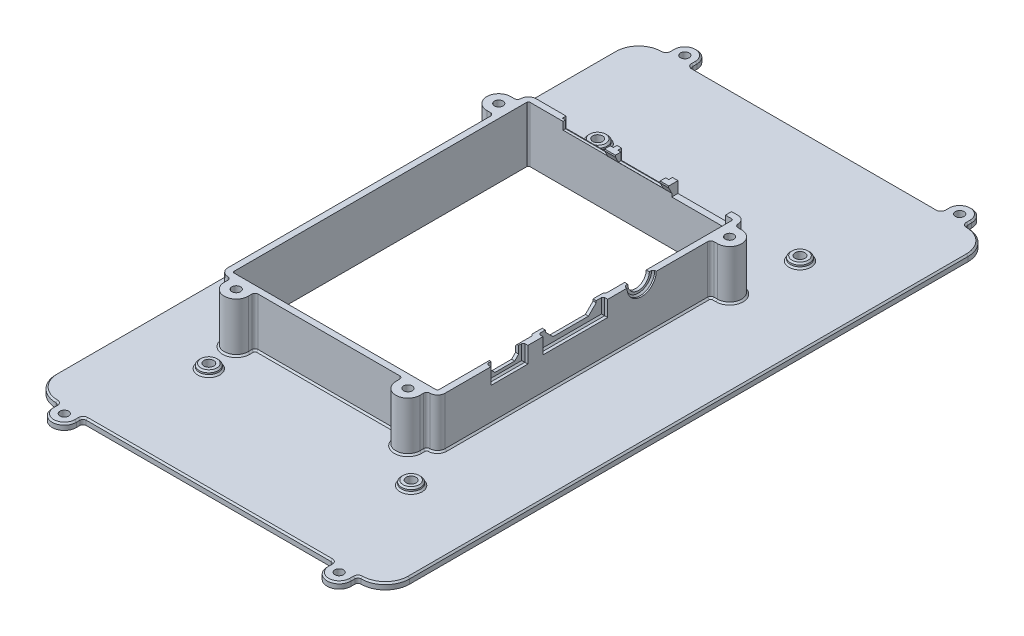
from build123d import *

# Parameters (mm, degrees)
BASE_DEPTH                  = 16.1
SHELL_T                     = -2
BOARD_CLAMPS_DEPTH          = 16.1
BOARD_CLAMP_FILLETS_R       = 1
SKETCH7_W                   = 17.4
SKETCH7_H                   = 3.6
SKETCH7_W_2                 = 14.5
SKETCH7_H_2                 = 2.47
IO_CUTOUT_DEPTH             = 2
SKETCH8_W                   = 16.5
SKETCH8_H                   = 3.47
IO_APPROACH_DEPTH           = 1.2
IO_SUPPORT_DEPTH            = 20.8
SKETCH10_W                  = 14.5
SKETCH10_H                  = 2.47
IO_SUPPORT_CUTOUT_DEPTH     = 1
SKETCH11_W                  = 24
SKETCH11_H                  = 4.62
SKETCH11_W_2                = 15
SKETCH11_H_2                = 5.75
HDMI_SUPPORT_DEPTH          = 0.5
HDMI_SUPPORT_CHAMFER_SIZE   = 0.5
SKETCH12_W                  = 12
SKETCH12_H                  = 5.25
SKETCH12_W_2                = 21
SKETCH12_H_2                = 5.12
HDMI_APPROACH_DEPTH         = 1.5
SKETCH13_W                  = 9
SKETCH13_H                  = 3.75
SKETCH13_W_2                = 16.5
SKETCH13_H_2                = 3.12
HDMI_CUTOUT_DEPTH           = 1
HDMI_APPROACH_CHAMFER_SIZE  = 0.5
USB_CHAMFER_SIZE            = 1.3
HDMI_CHAMFER_SIZE           = 2.5
SKETCH16_R                  = 3.5
AUDIO_CUTOUT_DEPTH          = 2
SKETCH17_R                  = 4.75
AUDIO_APPROACH_DEPTH        = 1
AUDIO_APPROACH_CHAMFER_SIZE = 0.5
SCREEN_START                = 2
SCREEN_BASE_DEPTH           = 2
SKETCH15_R                  = 1.4
BOARD_CLAMP_TAPS_DEPTH      = 182.548250611
SKETCH20_R                  = 3.1
LEG_SUPPORTS_DEPTH          = 1.5
SKETCH21_R                  = 1.6
LEG_HOLES_DEPTH             = 182.232771043
SCREEN_CLAMPS_DEPTH         = 2
SCREEN_CLAMP_FILLETS_R      = 1
SKETCH23_R                  = 1.4
SCREEN_CLAMP_TAPS_DEPTH     = 187.443721535
SHELL_CHAMFER_SIZE          = 0.5


with BuildPart() as part:
    # Sketch2 → Base (new body)
    with BuildSketch(Plane(origin=(0, 0, 0), x_dir=(1, 0, 0), z_dir=(0, 1, 0))):
        with BuildLine():
            Line((2.5, 0), (68, 0))
            ThreePointArc((68, 0), (69.767766953, 0.732233047), (70.5, 2.5))
            Line((70.5, 2.5), (70.5, 97.5))
            ThreePointArc((70.5, 97.5), (69.767766953, 99.267766953), (68, 100))
            Line((68, 100), (2.5, 100))
            ThreePointArc((2.5, 100), (0.732233047, 99.267766953), (0, 97.5))
            Line((0, 97.5), (0, 2.5))
            ThreePointArc((0, 2.5), (0.732233047, 0.732233047), (2.5, 0))
        make_face()
    extrude(amount=BASE_DEPTH)

    # Shell
    shell_openings = [part.faces().sort_by_distance(p)[0] for p in [
        (35.25, 16.1, -50),
        (35.25, 0, -50),
    ]]
    offset(amount=SHELL_T, openings=shell_openings, kind=Kind.INTERSECTION)

    # Sketch14 → Board Clamps (add)
    with BuildSketch(Plane.XZ):
        with BuildLine():
            Line((-2.2, -88.7), (0, -88.7))
            Line((0, -88.7), (0, -96.5))
            Line((0, -96.5), (-2.2, -96.5))
            ThreePointArc((-2.2, -96.5), (-6.1, -92.6), (-2.2, -88.7))
        make_face()
        with BuildLine():
            Line((3.5, 2.2), (3.5, 0))
            Line((3.5, 0), (11.3, 0))
            Line((11.3, 0), (11.3, 2.2))
            ThreePointArc((11.3, 2.2), (7.4, 6.1), (3.5, 2.2))
        make_face()
        with BuildLine():
            Line((72.7, -88.7), (70.5, -88.7))
            Line((70.5, -88.7), (70.5, -96.5))
            Line((70.5, -96.5), (72.7, -96.5))
            ThreePointArc((72.7, -96.5), (76.6, -92.6), (72.7, -88.7))
        make_face()
        with BuildLine():
            Line((59.2, 0), (59.2, 2.2))
            ThreePointArc((59.2, 2.2), (63.1, 6.1), (67, 2.2))
            Line((67, 2.2), (67, 0))
            Line((67, 0), (59.2, 0))
        make_face()
    extrude(amount=-BOARD_CLAMPS_DEPTH)

    # Board Clamp Fillets
    board_clamp_fillets_edges = [part.edges().sort_by_distance(p)[0] for p in [
        (0, 8.05, -96.5),
        (0, 8.05, -88.7),
        (3.5, 8.05, 0),
        (11.3, 8.05, 0),
        (70.5, 8.05, -88.7),
        (70.5, 8.05, -96.5),
        (59.2, 8.05, 0),
        (67, 8.05, 0),
    ]]
    fillet(board_clamp_fillets_edges, radius=BOARD_CLAMP_FILLETS_R - 0.0001)  # a hair under: the kernel refuses the full size

    # Sketch7 → IO Cutout (cut)
    with BuildSketch(Plane(origin=(0, 0, -100), x_dir=(-1, 0, 0), z_dir=(0, 0, -1))):
        with Locations((-57.25, 14.3)):
            Rectangle(SKETCH7_W, SKETCH7_H)
        with Locations((-38.5, 14.865)):
            Rectangle(SKETCH7_W_2, SKETCH7_H_2)
        with Locations((-20.5, 14.865)):
            Rectangle(SKETCH7_W_2, SKETCH7_H_2)
    extrude(amount=-IO_CUTOUT_DEPTH, mode=Mode.SUBTRACT)

    # Sketch8 → IO Approach (cut)
    with BuildSketch(Plane(origin=(0, 0, -100), x_dir=(-1, 0, 0), z_dir=(0, 0, -1))):
        with Locations((-38.5, 14.365)):
            Rectangle(SKETCH8_W, SKETCH8_H)
        with Locations((-20.5, 14.365)):
            Rectangle(SKETCH8_W, SKETCH8_H)
    extrude(amount=-IO_APPROACH_DEPTH, mode=Mode.SUBTRACT)

    # Sketch9 → IO Support (add)
    with BuildSketch(Plane(origin=(48.55, 0, 0), x_dir=(0, 0, -1), z_dir=(1, 0, 0))):
        Polygon((98, 16.1), (97, 16.1), (97, 15.55), (98, 13.55), align=None)
    extrude(amount=-IO_SUPPORT_DEPTH)

    # Sketch10 → IO Support Cutout (cut)
    with BuildSketch(Plane(origin=(0, 0, -98), x_dir=(-1, 0, 0), z_dir=(0, 0, -1))):
        with Locations((-38.5, 14.865)):
            Rectangle(SKETCH10_W, SKETCH10_H)
    extrude(amount=-IO_SUPPORT_CUTOUT_DEPTH, mode=Mode.SUBTRACT)

    # Sketch11 → HDMI Support (add)
    with BuildSketch(Plane.ZY.offset(-68.5)):
        with Locations((-44.75, 13.79)):
            Rectangle(SKETCH11_W, SKETCH11_H)
        with Locations((-23.35, 13.225)):
            Rectangle(SKETCH11_W_2, SKETCH11_H_2)
    extrude(amount=HDMI_SUPPORT_DEPTH)

    # HDMI Support Chamfer
    hdmi_support_chamfer_edges = [part.edges().sort_by_distance(p)[0] for p in [
        (68, 16.1, -23.35),
        (68, 13.225, -15.85),
        (68, 10.35, -23.35),
        (68, 13.225, -30.85),
        (68, 13.79, -56.75),
        (68, 11.48, -44.75),
        (68, 13.79, -32.75),
    ]]
    chamfer(hdmi_support_chamfer_edges, length=HDMI_SUPPORT_CHAMFER_SIZE - 0.0001)  # a hair under: the kernel refuses the full size

    # Sketch12 → HDMI Approach (cut)
    with BuildSketch(Plane(origin=(70.5, 0, 0), x_dir=(0, 0, -1), z_dir=(1, 0, 0))):
        with Locations((23.35, 13.475)):
            Rectangle(SKETCH12_W, SKETCH12_H)
        with Locations((44.75, 13.54)):
            Rectangle(SKETCH12_W_2, SKETCH12_H_2)
    extrude(amount=-HDMI_APPROACH_DEPTH, mode=Mode.SUBTRACT)

    # Sketch13 → HDMI Cutout (cut)
    with BuildSketch(Plane(origin=(69, 0, 0), x_dir=(0, 0, -1), z_dir=(1, 0, 0))):
        with Locations((23.35, 14.225)):
            Rectangle(SKETCH13_W, SKETCH13_H)
        with Locations((44.75, 14.54)):
            Rectangle(SKETCH13_W_2, SKETCH13_H_2)
    extrude(amount=-HDMI_CUTOUT_DEPTH, mode=Mode.SUBTRACT)

    # HDMI Approach Chamfer
    hdmi_approach_chamfer_edges = [part.edges().sort_by_distance(p)[0] for p in [
        (69, 13.475, -17.35),
        (69, 13.475, -29.35),
        (69, 10.85, -23.35),
        (69, 13.54, -34.25),
        (69, 13.54, -55.25),
        (69, 10.98, -44.75),
    ]]
    chamfer(hdmi_approach_chamfer_edges, length=HDMI_APPROACH_CHAMFER_SIZE)

    # USB Chamfer
    usb_chamfer_edges = [part.edges().sort_by_distance(p)[0] for p in [
        (68.5, 12.35, -27.85),
        (68.5, 12.35, -18.85),
    ]]
    chamfer(usb_chamfer_edges, length=USB_CHAMFER_SIZE)

    # HDMI Chamfer
    hdmi_chamfer_edges = [part.edges().sort_by_distance(p)[0] for p in [
        (68.5, 12.98, -53),
        (68.5, 12.98, -36.5),
    ]]
    chamfer(hdmi_chamfer_edges, length=HDMI_CHAMFER_SIZE)

    # Sketch16 → Audio Cutout (cut)
    with BuildSketch(Plane(origin=(70.5, 0, 0), x_dir=(0, 0, -1), z_dir=(1, 0, 0))):
        with Locations((66.25, 16.1)):
            Circle(SKETCH16_R)
    extrude(amount=-AUDIO_CUTOUT_DEPTH, mode=Mode.SUBTRACT)

    # Sketch17 → Audio Approach (cut)
    with BuildSketch(Plane(origin=(70.5, 0, 0), x_dir=(0, 0, -1), z_dir=(1, 0, 0))):
        with Locations((66.25, 16.1)):
            Circle(SKETCH17_R)
    extrude(amount=-AUDIO_APPROACH_DEPTH, mode=Mode.SUBTRACT)

    # Audio Approach Chamfer
    audio_approach_chamfer_edges = [part.edges().sort_by_distance(p)[0] for p in [
        (69.5, 11.35, -66.25),
    ]]
    chamfer(audio_approach_chamfer_edges, length=AUDIO_APPROACH_CHAMFER_SIZE)

    # Sketch19 → Screen Base (add)
    with BuildSketch(Plane.XZ.offset(SCREEN_START)):
        with BuildLine():
            Line((-6.55, 46.74), (92.45, 46.74))
            ThreePointArc((92.45, 46.74), (98.022001436, 44.432001436), (100.33, 38.86))
            Line((100.33, 38.86), (100.33, -142.34))
            ThreePointArc((100.33, -142.34), (98.022001436, -147.912001436), (92.45, -150.22))
            Line((92.45, -150.22), (-6.55, -150.22))
            ThreePointArc((-6.55, -150.22), (-12.122001436, -147.912001436), (-14.43, -142.34))
            Line((-14.43, -142.34), (-14.43, 38.86))
            ThreePointArc((-14.43, 38.86), (-12.122001436, 44.432001436), (-6.55, 46.74))
        make_face()
        with BuildLine():
            Line((2.5, -98), (68, -98))
            ThreePointArc((68, -98), (68.353553391, -97.853553391), (68.5, -97.5))
            Line((68.5, -97.5), (68.5, -2.5))
            ThreePointArc((68.5, -2.5), (68.353553391, -2.146446609), (68, -2))
            Line((68, -2), (2.5, -2))
            ThreePointArc((2.5, -2), (2.146446609, -2.146446609), (2, -2.5))
            Line((2, -2.5), (2, -97.5))
            ThreePointArc((2, -97.5), (2.146446609, -97.853553391), (2.5, -98))
        make_face(mode=Mode.SUBTRACT)
    extrude(amount=-SCREEN_BASE_DEPTH)

    # Sketch15 → Board Clamp Taps (cut, through all)
    with BuildSketch(Plane(origin=(0, 16.1, 0), x_dir=(1, 0, 0), z_dir=(0, 1, 0))):
        with Locations(Location((-2.2, 92.6, 0), (0, 0, 270))):
            Circle(SKETCH15_R)
        with Locations(Location((72.7, 92.6, 0), (0, 0, 270))):
            Circle(SKETCH15_R)
        with Locations(Location((63.1, -2.2, 0), (0, 0, 270))):
            Circle(SKETCH15_R)
        with Locations(Location((7.4, -2.2, 0), (0, 0, 270))):
            Circle(SKETCH15_R)
    extrude(amount=-BOARD_CLAMP_TAPS_DEPTH, mode=Mode.SUBTRACT)

    # Sketch20 → Leg Supports (add)
    with BuildSketch(Plane(origin=(0, 0, 0), x_dir=(1, 0, 0), z_dir=(0, 1, 0))):
        with Locations(Location((9.15, 113.35, 0), (0, 0, 90))):
            Circle(SKETCH20_R)
        with Locations(Location((74.8, 113.35, 0), (0, 0, 90))):
            Circle(SKETCH20_R)
        with Locations(Location((74.8, -12.85, 0), (0, 0, 90))):
            Circle(SKETCH20_R)
        with Locations(Location((9.15, -12.85, 0), (0, 0, 90))):
            Circle(SKETCH20_R)
    extrude(amount=LEG_SUPPORTS_DEPTH)

    # Sketch21 → Leg Holes (cut, through all)
    with BuildSketch(Plane(origin=(0, 1.5, 0), x_dir=(1, 0, 0), z_dir=(0, 1, 0))):
        with Locations(Location((9.15, 113.35, 0), (0, 0, 270))):
            Circle(SKETCH21_R)
        with Locations(Location((74.8, 113.35, 0), (0, 0, 270))):
            Circle(SKETCH21_R)
        with Locations(Location((74.8, -12.85, 0), (0, 0, 270))):
            Circle(SKETCH21_R)
        with Locations(Location((9.15, -12.85, 0), (0, 0, 270))):
            Circle(SKETCH21_R)
    extrude(amount=-LEG_HOLES_DEPTH, mode=Mode.SUBTRACT)

    # Sketch22 → Screen Clamps (add)
    with BuildSketch(Plane(origin=(0, 0, 0), x_dir=(1, 0, 0), z_dir=(0, 1, 0))):
        with BuildLine():
            Line((-5.55, 152.42), (-5.55, 150.22))
            Line((-5.55, 150.22), (2.25, 150.22))
            Line((2.25, 150.22), (2.25, 152.42))
            ThreePointArc((2.25, 152.42), (-1.65, 156.32), (-5.55, 152.42))
        make_face()
        with BuildLine():
            Line((83.65, 152.42), (83.65, 150.22))
            Line((83.65, 150.22), (91.45, 150.22))
            Line((91.45, 150.22), (91.45, 152.42))
            ThreePointArc((91.45, 152.42), (87.55, 156.32), (83.65, 152.42))
        make_face()
        with BuildLine():
            Line((-5.55, -48.94), (-5.55, -46.74))
            Line((-5.55, -46.74), (2.25, -46.74))
            Line((2.25, -46.74), (2.25, -48.94))
            ThreePointArc((2.25, -48.94), (-1.65, -52.84), (-5.55, -48.94))
        make_face()
        with BuildLine():
            Line((83.65, -48.94), (83.65, -46.74))
            Line((83.65, -46.74), (91.45, -46.74))
            Line((91.45, -46.74), (91.45, -48.94))
            ThreePointArc((91.45, -48.94), (87.55, -52.84), (83.65, -48.94))
        make_face()
    extrude(amount=-SCREEN_CLAMPS_DEPTH)

    # Screen Clamp Fillets
    screen_clamp_fillets_edges = [part.edges().sort_by_distance(p)[0] for p in [
        (-5.55, -1, -150.22),
        (2.25, -1, -150.22),
        (83.65, -1, -150.22),
        (91.45, -1, -150.22),
        (2.25, -1, 46.74),
        (-5.55, -1, 46.74),
        (91.45, -1, 46.74),
        (83.65, -1, 46.74),
    ]]
    fillet(screen_clamp_fillets_edges, radius=SCREEN_CLAMP_FILLETS_R - 0.0001)  # a hair under: the kernel refuses the full size

    # Sketch23 → Screen Clamp Taps (cut, through all)
    with BuildSketch(Plane(origin=(0, 0, 0), x_dir=(1, 0, 0), z_dir=(0, 1, 0))):
        with Locations(Location((-1.65, 152.42, 0), (0, 0, 270))):
            Circle(SKETCH23_R)
        with Locations(Location((87.55, 152.42, 0), (0, 0, 270))):
            Circle(SKETCH23_R)
        with Locations(Location((-1.65, -48.94, 0), (0, 0, 270))):
            Circle(SKETCH23_R)
        with Locations(Location((87.55, -48.94, 0), (0, 0, 270))):
            Circle(SKETCH23_R)
    extrude(amount=-SCREEN_CLAMP_TAPS_DEPTH, mode=Mode.SUBTRACT)

    # Shell Chamfer
    shell_chamfer_edges = [part.edges().sort_by_distance(p)[0] for p in [
        (0, 0, -45.10005),
        (-1.59995, 0, -88.7),
        (0.732233047, 0, -0.732233047),
        (72.09995, 0, -96.5),
        (58.907136071, 0, 0.292863929),
        (67.292863929, 0, 0.292863929),
        (11.592863929, 0, 0.292863929),
        (3.207136071, 0, 0.292863929),
        (-0.292863929, 0, -96.792863929),
        (-0.292863929, 0, -88.407136071),
        (70.792863929, 0, -88.407136071),
        (70.792863929, 0, -96.792863929),
        (-6.1, 0, -92.6),
        (-1.59995, 0, -96.5),
        (-12.122001436, 0, -147.912001436),
        (98.022001436, 0, -147.912001436),
        (100.33, 0, -51.74),
        (98.022001436, 0, 44.432001436),
        (-12.122001436, 0, 44.432001436),
        (-14.43, 0, -51.74),
        (9.15, 0, -110.25),
        (9.15, 1.5, -110.25),
        (74.8, 0, -110.25),
        (74.8, 1.5, -110.25),
        (74.8, 0, 15.95),
        (74.8, 1.5, 15.95),
        (9.15, 0, 15.95),
        (9.15, 1.5, 15.95),
        (7.4, 0, 6.1),
        (3.5, 0, 1.59995),
        (-1.65, 0, -156.32),
        (-5.55, 0, -151.81995),
        (87.55, 0, -156.32),
        (83.65, 0, -151.81995),
        (-1.65, 0, 52.84),
        (2.25, 0, 48.33995),
        (87.55, 0, 52.84),
        (91.45, 0, 48.33995),
        (42.95, 0, 46.74),
        (83.65, 0, 48.33995),
        (-5.55, 0, 48.33995),
        (42.95, 0, -150.22),
        (2.25, 0, -151.81995),
        (91.45, 0, -151.81995),
        (83.357136071, 0, 47.032863929),
        (-5.842863929, 0, 47.032863929),
        (2.542863929, 0, 47.032863929),
        (91.742863929, 0, 47.032863929),
        (2.542863929, 0, -150.512863929),
        (91.742863929, 0, -150.512863929),
        (83.357136071, 0, -150.512863929),
        (-5.842863929, 0, -150.512863929),
        (76.6, 0, -92.6),
        (72.09995, 0, -88.7),
        (63.1, 0, 6.1),
        (0.732233047, 0, -99.267766953),
        (59.2, 0, 1.59995),
        (35.25, 0, -100),
        (69.767766953, 0, -99.267766953),
        (70.5, 0, -45.10005),
        (35.25, 0, 0),
        (69.767766953, 0, -0.732233047),
        (67, 0, 1.59995),
        (11.3, 0, 1.59995),
    ]]
    chamfer(shell_chamfer_edges, length=SHELL_CHAMFER_SIZE)


solid = part.part
